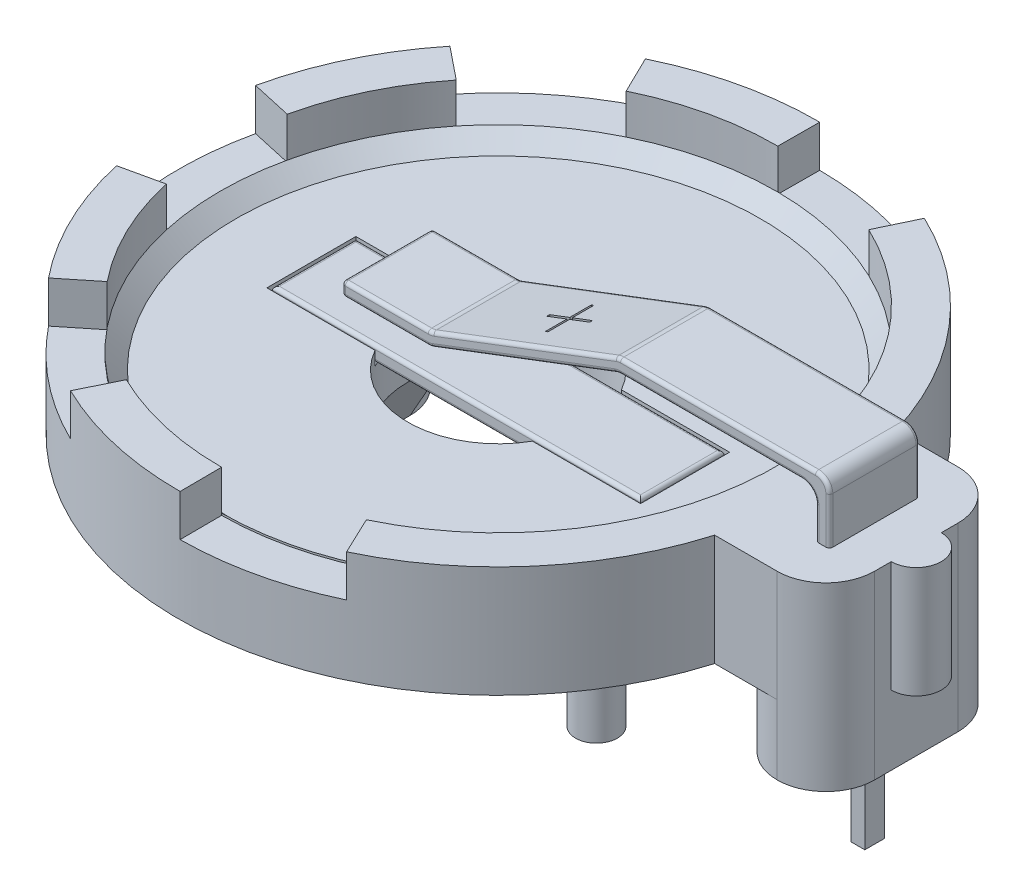
from build123d import *

# Parameters (mm, degrees)
SKETCH3_R             = 3.25
BOSS_EXTRUDE2_DEPTH   = 4
SKETCH7_R             = 10
CUT_EXTRUDE1_DEPTH    = 2
CHAMFER3_SIZE         = 0.57
CUT_EXTRUDE2_DEPTH    = 1.5
SKETCH9_R             = 0.75
SKETCH9_W             = 3.5
SKETCH9_H             = 6.5
BOSS_EXTRUDE6_DEPTH   = 2.5
FILLET1_R             = 1.75
RIB1_REACH            = 21.344
SKETCH10_WALL_W       = 43.505635646
SKETCH10_WALL_H       = 3
RIB2_REACH            = 21.344
SKETCH12_WALL_W       = 43.562374554
SKETCH12_WALL_H       = 3
SKETCH13_W            = 0.5
SKETCH13_H            = 0.7
BOSS_EXTRUDE7_DEPTH   = 3.5
BOSS_EXTRUDE7_2_DEPTH = 3.5
CUT_EXTRUDE3_START    = -0.5
CUT_EXTRUDE3_DEPTH    = 0.5
SKETCH15_W            = 13.237663296
SKETCH15_H            = 3
BOSS_EXTRUDE8_DEPTH   = 0.55
BOSS_EXTRUDE9_DEPTH   = 1.625
FILLET2_R             = 0.5
FILLET3_R             = 0.125
FILLET4_R             = 0.125
CUT_EXTRUDE4_DEPTH    = 0.125
BOSS_EXTRUDE10_DEPTH  = 4


with BuildPart() as part:
    # Sketch3 → Boss-Extrude2 (new body)
    with BuildSketch(Plane(origin=(0, 0, 0), x_dir=(1, 0, 0), z_dir=(0, 1, 0))):
        with BuildLine():
            Line((15.031205736, -3.25), (11.031205736, -3.25))
            ThreePointArc((11.031205736, -3.25), (-11.5, 0), (11.031205736, 3.25))
            Line((11.031205736, 3.25), (15.031205736, 3.25))
            Line((15.031205736, 3.25), (15.031205736, -3.25))
        make_face()
        with Locations(Location((0, 0, 0), (0, 0, 270))):
            Circle(SKETCH3_R, mode=Mode.SUBTRACT)
    extrude(amount=BOSS_EXTRUDE2_DEPTH)

    # Sketch7 → Cut-Extrude1 (cut)
    with BuildSketch(Plane(origin=(0, 4, 0), x_dir=(1, 0, 0), z_dir=(0, 1, 0))):
        with Locations(Location((0, 0, 0), (0, 0, 270))):
            Circle(SKETCH7_R)
    extrude(amount=-CUT_EXTRUDE1_DEPTH, mode=Mode.SUBTRACT)

    # Chamfer3
    chamfer3_edges = [part.edges().sort_by_distance(p)[0] for p in [
        (0, 2, -10),
    ]]
    chamfer(chamfer3_edges, length=CHAMFER3_SIZE)

    # Sketch8 → Cut-Extrude2 (cut)
    with BuildSketch(Plane(origin=(0, 4, 0), x_dir=(1, 0, 0), z_dir=(0, 1, 0))):
        with BuildLine():
            Line((-11.22497216, 2.5), (-9.760845357, 2.173913043))
            ThreePointArc((-9.760845357, 2.173913043), (-10, 0), (-9.760845357, -2.173913043))
            Line((-9.760845357, -2.173913043), (-11.22497216, -2.5))
            ThreePointArc((-11.22497216, -2.5), (-11.5, 0), (-11.22497216, 2.5))
        make_face()
        with BuildLine():
            Line((-5.044076962, 10.334761129), (-4.38615388, 8.986748808))
            ThreePointArc((-4.38615388, 8.986748808), (-6.234898019, 7.818314825), (-7.785421195, 6.275923583))
            Line((-7.785421195, 6.275923583), (-8.953234374, 7.21731212))
            ThreePointArc((-8.953234374, 7.21731212), (-7.170132721, 8.991062048), (-5.044076962, 10.334761129))
        make_face()
        with BuildLine():
            Line((4.935111069, 10.387236338), (4.29140093, 9.032379424))
            ThreePointArc((4.29140093, 9.032379424), (2.22520934, 9.749279122), (0.05258392, 9.999861746))
            Line((0.05258392, 9.999861746), (0.060471508, 11.499841007))
            ThreePointArc((0.060471508, 11.499841007), (2.55899074, 11.21167099), (4.935111069, 10.387236338))
        make_face()
        with BuildLine():
            Line((0.060471508, -11.499841007), (0.05258392, -9.999861746))
            ThreePointArc((0.05258392, -9.999861746), (2.22520934, -9.749279122), (4.29140093, -9.032379424))
            Line((4.29140093, -9.032379424), (4.935111069, -10.387236338))
            ThreePointArc((4.935111069, -10.387236338), (2.55899074, -11.21167099), (0.060471508, -11.499841007))
        make_face()
        with BuildLine():
            Line((-8.953234374, -7.21731212), (-7.785421195, -6.275923583))
            ThreePointArc((-7.785421195, -6.275923583), (-6.234898019, -7.818314825), (-4.38615388, -8.986748808))
            Line((-4.38615388, -8.986748808), (-5.044076962, -10.334761129))
            ThreePointArc((-5.044076962, -10.334761129), (-7.170132721, -8.991062048), (-8.953234374, -7.21731212))
        make_face()
    extrude(amount=-CUT_EXTRUDE2_DEPTH, mode=Mode.SUBTRACT)

    # Sketch9 → Boss-Extrude6 (add)
    with BuildSketch(Plane.XZ):
        with Locations(Location((0, -9.65, 0), (0, 0, 90))):
            Circle(SKETCH9_R)
        with Locations(Location((-8.357145147, 4.825, 0), (0, 0, 90))):
            Circle(SKETCH9_R)
        with Locations(Location((8.357145147, 4.825, 0), (0, 0, 90))):
            Circle(SKETCH9_R)
        with Locations((13.281205736, 0)):
            Rectangle(SKETCH9_W, SKETCH9_H)
        with Locations((-6.418794264, 0)):
            Rectangle(SKETCH9_W, SKETCH9_H)
    extrude(amount=BOSS_EXTRUDE6_DEPTH)

    # Fillet1
    fillet1_edges = [part.edges().sort_by_distance(p)[0] for p in [
        (15.031205736, 0.75, -3.25),
        (15.031205736, 0.75, 3.25),
        (-4.668794264, -1.25, -3.25),
        (-8.168794264, -1.25, -3.25),
        (-4.668794264, -1.25, 3.25),
        (-8.168794264, -1.25, 3.25),
        (11.531205736, -1.25, 3.25),
        (11.531205736, -1.25, -3.25),
    ]]
    fillet(fillet1_edges, radius=FILLET1_R - 0.0001)  # a hair under: the kernel refuses the full size

    # Sketch10 wall → Rib1 (add, up to next)
    with BuildSketch(Plane(origin=(10.881205736, -1.25, 0), x_dir=(0.461352736642, -0.887216801235, 0), z_dir=(0.887216801235, 0.461352736642, 0)), mode=Mode.PRIVATE) as rib1_sk1:
        Rectangle(SKETCH10_WALL_W, SKETCH10_WALL_H)
    rib1_tool1 = extrude(rib1_sk1.sketch, amount=RIB1_REACH, mode=Mode.PRIVATE) - part.part
    add(rib1_tool1.solids().sort_by_distance((10.881205736, -1.25, 0))[0])

    # Sketch12 wall → Rib2 (add, up to next)
    with BuildSketch(Plane(origin=(-3.959397132, -1.25, 0), x_dir=(-0.493572719698, -0.869704530498, 0), z_dir=(0.869704530498, -0.493572719698, 0)), mode=Mode.PRIVATE) as rib2_sk1:
        Rectangle(SKETCH12_WALL_W, SKETCH12_WALL_H)
    rib2_tool1 = extrude(rib2_sk1.sketch, amount=-RIB2_REACH, mode=Mode.PRIVATE) - part.part
    add(rib2_tool1.solids().sort_by_distance((-3.959397132, -1.25, 0))[0])

    # Sketch14 → Cut-Extrude3 (cut)
    with BuildSketch(Plane(origin=(0, 2, 0), x_dir=(1, 0, 0), z_dir=(0, 1, 0)).offset(CUT_EXTRUDE3_START)):
        with BuildLine():
            Line((2.828869032, 1.6), (6.718869032, 1.6))
            Line((6.718869032, 1.6), (6.718869032, -1.6))
            Line((6.718869032, -1.6), (2.828869032, -1.6))
            ThreePointArc((2.828869032, -1.6), (3.25, 0), (2.828869032, 1.6))
        make_face()
        with BuildLine():
            Line((-6.718794264, 1.6), (-2.828869032, 1.6))
            ThreePointArc((-2.828869032, 1.6), (-3.25, 0), (-2.828869032, -1.6))
            Line((-2.828869032, -1.6), (-6.718794264, -1.6))
            Line((-6.718794264, -1.6), (-6.718794264, 1.6))
        make_face()
    extrude(amount=CUT_EXTRUDE3_DEPTH, mode=Mode.SUBTRACT)

    # Sketch20 → Boss-Extrude10 (add)
    with BuildSketch(Plane(origin=(0, 4, 0), x_dir=(1, 0, 0), z_dir=(0, 1, 0))):
        with BuildLine():
            Line((15.031205736, 0.9), (15.031205736, -0.9))
            ThreePointArc((15.031205736, -0.9), (15.931205736, 0), (15.031205736, 0.9))
        make_face()
    extrude(amount=-BOSS_EXTRUDE10_DEPTH)


with BuildPart() as body_2:
    # Sketch13 → Boss-Extrude7 (new body)
    with BuildSketch(Plane.XZ.offset(2.5)):
        with Locations((-6.718794264, 0)):
            Rectangle(SKETCH13_W, SKETCH13_H)
    extrude(amount=BOSS_EXTRUDE7_DEPTH)


with BuildPart() as body_3:
    # Sketch13 → Boss-Extrude7 2 (new body)
    with BuildSketch(Plane.XZ.offset(2.5)):
        with Locations((13.281205736, 0)):
            Rectangle(SKETCH13_W, SKETCH13_H)
    extrude(amount=BOSS_EXTRUDE7_2_DEPTH)


with BuildPart() as body_4:
    # Sketch15 → Boss-Extrude8 (new body)
    with BuildSketch(Plane(origin=(0, 1.5, 0), x_dir=(1, 0, 0), z_dir=(0, 1, 0))):
        with Locations((3.7384e-05, 0)):
            Rectangle(SKETCH15_W, SKETCH15_H)
    extrude(amount=BOSS_EXTRUDE8_DEPTH)

    # Fillet4
    fillet4_edges = [body_4.edges().sort_by_distance(p)[0] for p in [
        (6.618869032, 2.05, 0),
        (3.7384e-05, 2.05, -1.5),
        (-6.618794264, 2.05, 0),
        (3.7384e-05, 1.5, -1.5),
        (6.618869032, 1.5, 0),
        (3.7384e-05, 1.5, 1.5),
        (-6.618794264, 1.5, 0),
        (3.7384e-05, 2.05, 1.5),
    ]]
    fillet(fillet4_edges, radius=FILLET4_R)


with BuildPart() as body_5:
    # Sketch16 → Boss-Extrude9 (new, symmetric)
    with BuildSketch(Plane.XY):
        Polygon((13.281205736, 6.17), (5.931205736, 6.17), (-0.799012183, 3.611843094), (-3.999012183, 3.611843094), (-3.999012183, 3.111843094), (-0.799012183, 3.111843094), (5.931205736, 5.67), (13.031205736, 5.67), (13.031205736, 4), (13.531205736, 4), (13.531205736, 6.17), align=None)
    extrude(amount=BOSS_EXTRUDE9_DEPTH, both=True)

    # Fillet2
    fillet2_edges = [body_5.edges().sort_by_distance(p)[0] for p in [
        (5.931205736, 5.67, 0),
        (-0.799012183, 3.111843094, 0),
        (-0.799012183, 3.611843094, 0),
        (5.931205736, 6.17, 0),
        (13.531205736, 6.17, 0),
        (13.031205736, 5.67, 0),
    ]]
    fillet(fillet2_edges, radius=FILLET2_R)

    # Fillet3
    fillet3_edges = [body_5.edges().sort_by_distance(p)[0] for p in [
        (-2.444922393, 3.111843094, -1.625),
        (-3.999012183, 3.361843094, -1.625),
        (13.531205736, 4.835, -1.625),
        (13.531205736, 4.835, 1.625),
        (-3.999012183, 3.111843094, 0),
        (-3.999012183, 3.611843094, 0),
        (-3.999012183, 3.361843094, 1.625),
        (-2.444922393, 3.111843094, 1.625),
        (2.566096777, 4.390921547, -1.625),
        (2.566096777, 4.390921547, 1.625),
        (9.277115946, 5.67, -1.625),
        (-2.444922393, 3.611843094, -1.625),
        (2.566096777, 4.890921547, -1.625),
        (9.527115946, 6.17, -1.625),
        (13.031205736, 4.585, -1.625),
        (13.384759127, 6.023553391, -1.625),
        (5.932715919, 6.161776434, -1.625),
        (-0.800522366, 3.12006666, -1.625),
        (9.277115946, 5.67, 1.625),
        (13.031205736, 4.585, 1.625),
        (9.527115946, 6.17, 1.625),
        (2.566096777, 4.890921547, 1.625),
        (-2.444922393, 3.611843094, 1.625),
        (13.384759127, 6.023553391, 1.625),
        (5.932715919, 6.161776434, 1.625),
        (-0.800522366, 3.12006666, 1.625),
        (-0.800522366, 3.62006666, -1.625),
        (-0.800522366, 3.62006666, 1.625),
        (5.932715919, 5.661776434, -1.625),
        (5.932715919, 5.661776434, 1.625),
        (12.884759127, 5.523553391, -1.625),
        (12.884759127, 5.523553391, 1.625),
    ]]
    fillet(fillet3_edges, radius=FILLET3_R)

    # Sketch18 → Cut-Extrude4 (cut)
    with BuildSketch(Plane(origin=(-1.30042059, 3.421257678, 0), x_dir=(0.9347524888223904, 0.35529957027886616, 0), z_dir=(-0.3552995702788662, 0.9347524888223905, 0))):
        Polygon((4.086407672, 0.05), (3.311407672, 0.05), (3.311407672, -0.05), (4.086407672, -0.05), (4.086407672, -0.825), (4.186407672, -0.825), (4.186407672, -0.05), (4.961407672, -0.05), (4.961407672, 0.05), (4.186407672, 0.05), (4.186407672, 0.825), (4.086407672, 0.825), align=None)
    extrude(amount=-CUT_EXTRUDE4_DEPTH, mode=Mode.SUBTRACT)


solid = Compound([part.part, body_2.part, body_3.part, body_4.part, body_5.part])
